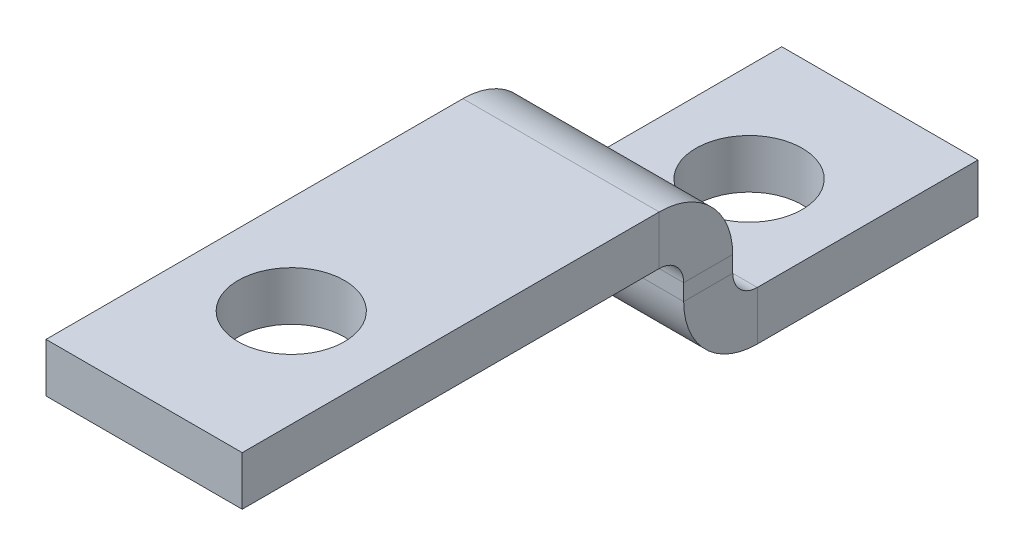
from build123d import *

# Parameters (mm, degrees)
BOSS_EXTRUDE1_DEPTH    = 3
SKETCH2_R              = 1.625
CUT_EXTRUDE1_DEPTH     = 13.854960132
SKETCH3_R              = 1.625
CUT_EXTRUDE2_DEPTH     = 16.215124055
CONVERT_SOLID1_START   = -3
CONVERT_SOLID1_DEPTH   = 6
CONVERT_SOLID1_2_DEPTH = 6


# Read off the part's stored shape, not the designer's step: Convert-Solid1
with BuildPart() as part:
    # Sketch1 → Boss-Extrude1 (new, symmetric)
    with BuildSketch(Plane(origin=(0, 0, 0), x_dir=(0, 0, -1), z_dir=(1, 0, 0))):
        Polygon((0, 3.5), (0, 0), (9, 0), (9, 1.5), (1.5, 1.5), (1.5, 5), (-13.5, 5), (-13.5, 3.5), align=None)
    extrude(amount=BOSS_EXTRUDE1_DEPTH, both=True)

    # Sketch2 → Cut-Extrude1 (cut, through all)
    with BuildSketch(Plane(origin=(0, 1.5, 1.5), x_dir=(1, 0, 0), z_dir=(0, 1, 0))):
        with Locations(Location((0, 6.5, 0), (0, 0, 270))):
            Circle(SKETCH2_R)
    extrude(amount=-CUT_EXTRUDE1_DEPTH, mode=Mode.SUBTRACT)

    # Sketch3 → Cut-Extrude2 (cut, through all)
    with BuildSketch(Plane(origin=(0, 3.5, -1), x_dir=(1, 0, 0), z_dir=(0, -1, 0))):
        with Locations(Location((0, 10, 0), (0, 0, 270))):
            Circle(SKETCH3_R)
    extrude(amount=-CUT_EXTRUDE2_DEPTH, mode=Mode.SUBTRACT)

    # Convert-Solid1 outline → Convert-Solid1 (cut)
    with BuildSketch(Plane.YZ.offset(CONVERT_SOLID1_START)):
        with BuildLine():
            ThreePointArc((0, -2.25), (0.659009742, -0.659009742), (2.25, 0))
            Line((2.25, 0), (0, 0))
            Line((0, 0), (0, -2.25))
        make_face()
        with BuildLine():
            ThreePointArc((5, 0.75), (4.340990258, -0.840990258), (2.75, -1.5))
            Line((2.75, -1.5), (5, -1.5))
            Line((5, -1.5), (5, 0.75))
        make_face()
    extrude(amount=CONVERT_SOLID1_DEPTH, mode=Mode.SUBTRACT)

    # Convert-Solid1 2 outline → Convert-Solid1 2 (add)
    with BuildSketch(Plane.YZ.offset(CONVERT_SOLID1_START)):
        with BuildLine():
            ThreePointArc((3.5, 0.75), (3.280330086, 0.219669914), (2.75, 0))
            Line((2.75, 0), (3.5, 0))
            Line((3.5, 0), (3.5, 0.75))
        make_face()
        with BuildLine():
            ThreePointArc((1.5, -2.25), (1.719669914, -1.719669914), (2.25, -1.5))
            Line((2.25, -1.5), (1.5, -1.5))
            Line((1.5, -1.5), (1.5, -2.25))
        make_face()
    extrude(amount=CONVERT_SOLID1_2_DEPTH)


solid = part.part
